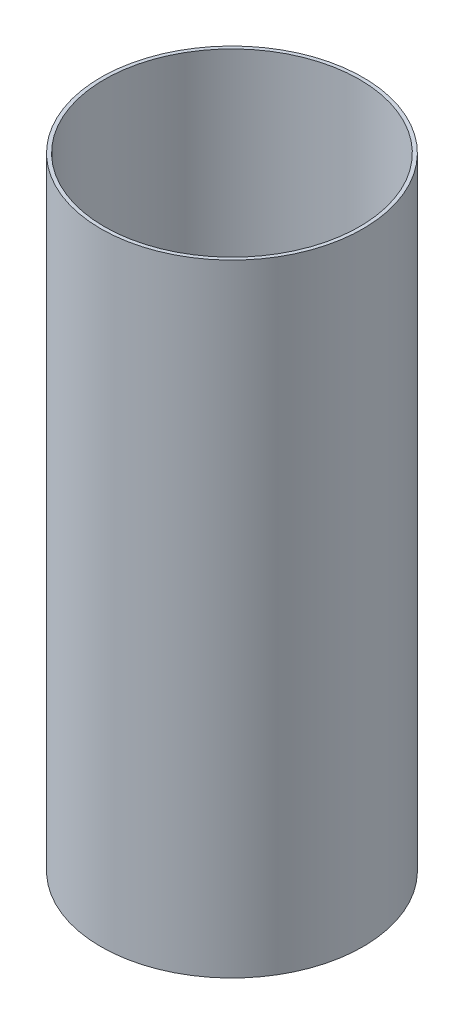
from build123d import *

# Parameters (mm, degrees)
SKETCH1_R           = 78.5876
SKETCH1_R_2         = 76.454
BOSS_EXTRUDE1_DEPTH = 372.618


with BuildPart() as part:
    # Sketch1 → Boss-Extrude1 (new body)
    with BuildSketch(Plane(origin=(0, 0, 0), x_dir=(1, 0, 0), z_dir=(0, 1, 0))):
        Circle(SKETCH1_R)
        Circle(SKETCH1_R_2, mode=Mode.SUBTRACT)
    extrude(amount=BOSS_EXTRUDE1_DEPTH)


solid = part.part
